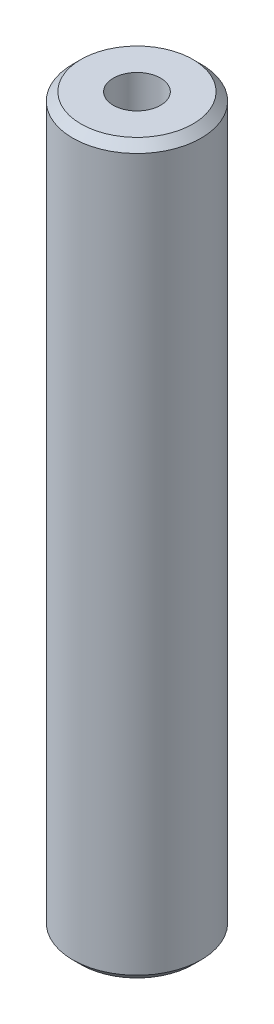
from build123d import *

# Parameters (mm, degrees)
SKETCH1_R           = 27.5
BOSS_EXTRUDE1_DEPTH = 312.08444817
SKETCH2_R           = 10.125583353
CUT_EXTRUDE1_DEPTH  = 315.498335114
CHAMFER1_SIZE       = 3.508208626


with BuildPart() as part:
    # Sketch1 → Boss-Extrude1 (new body)
    with BuildSketch(Plane(origin=(0, 0, 0), x_dir=(1, 0, 0), z_dir=(0, 1, 0))):
        Circle(SKETCH1_R)
    extrude(amount=BOSS_EXTRUDE1_DEPTH)

    # Sketch2 → Cut-Extrude1 (cut, through all)
    with BuildSketch(Plane(origin=(0, 0, 0), x_dir=(1, 0, 0), z_dir=(0, 1, 0))):
        Circle(SKETCH2_R)
    extrude(amount=CUT_EXTRUDE1_DEPTH, mode=Mode.SUBTRACT)

    # Chamfer1
    chamfer1_edges = [part.edges().sort_by_distance(p)[0] for p in [
        (-27.5, 312.08444817, 0),
        (-27.5, 0, 0),
    ]]
    chamfer(chamfer1_edges, length=CHAMFER1_SIZE)


solid = part.part
